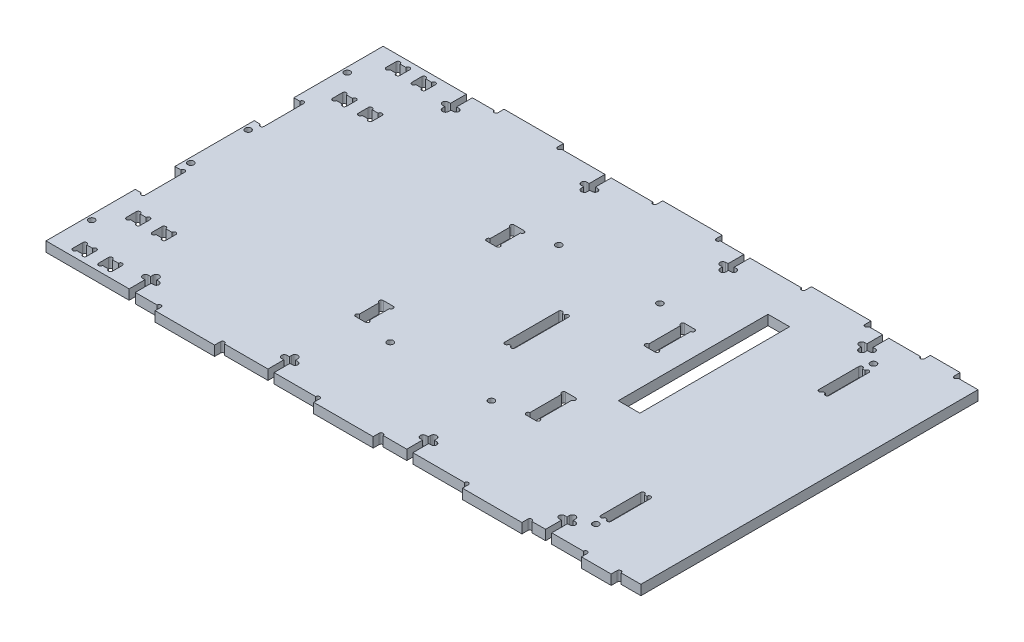
from build123d import *

# Parameters (mm, degrees)
SKETCH_1_W           = 300
SKETCH_1_H           = 170
EXTRUDE_1_DEPTH      = 5
SKETCH_2_W           = 5.2
SKETCH_2_H           = 27
SKETCH_2_H_2         = 20
CUT_EXTRUDE_1_DEPTH  = 10
SKETCH_3_R           = 1.55
CUT_EXTRUDE_2_DEPTH  = 10
SKETCH_4_W           = 5
SKETCH_4_H           = 20
CUT_EXTRUDE_3_DEPTH  = 5
SKETCH_5_R           = 1
CUT_EXTRUDE_4_DEPTH  = 10
SKETCH_8_W           = 30
SKETCH_8_H           = 3
SKETCH_8_W_2         = 15
EXTRUDE_2_DEPTH      = 5
SKETCH_9_R           = 1
CUT_EXTRUDE_6_DEPTH  = 5
SKETCH_13_W          = 7
SKETCH_13_H          = 5
CUT_EXTRUDE_9_DEPTH  = 10
SKETCH_14_R          = 1
CUT_EXTRUDE_10_DEPTH = 10
SKETCH_15_W          = 5
SKETCH_15_H          = 14
SKETCH_15_H_2        = 20
CUT_EXTRUDE_11_DEPTH = 10
SKETCH_16_R          = 1
CUT_EXTRUDE_12_DEPTH = 10
SKETCH_17_W          = 10.9
SKETCH_17_H          = 75.5
CUT_EXTRUDE_13_DEPTH = 10
CUT_EXTRUDE_5_DEPTH  = 10
SKETCH_18_R          = 6
CUT_EXTRUDE_14_DEPTH = 1.5
SKETCH_19_W          = 5.2
SKETCH_19_H          = 11.778826781
SKETCH_19_H_2        = 11.694797023
SKETCH_19_H_3        = 17.375654454
SKETCH_19_H_4        = 17.66182615
CUT_EXTRUDE_15_DEPTH = 10


with BuildPart() as part:
    # 스케치1 → 보스-돌출1 (new body)
    with BuildSketch(Plane(origin=(0, 0, 0), x_dir=(1, 0, 0), z_dir=(0, 1, 0))):
        with Locations((150, 85)):
            Rectangle(SKETCH_1_W, SKETCH_1_H)
    extrude(amount=EXTRUDE_1_DEPTH)

    # 스케치2 → 컷-돌출1 (cut)
    with BuildSketch(Plane.XZ):
        with Locations((162.5, -85)):
            Rectangle(SKETCH_2_W, SKETCH_2_H)
        with Locations((262.4, -30)):
            Rectangle(SKETCH_2_W, SKETCH_2_H_2)
        with Locations((262.4, -140)):
            Rectangle(SKETCH_2_W, SKETCH_2_H_2)
    extrude(amount=-CUT_EXTRUDE_1_DEPTH, mode=Mode.SUBTRACT)

    # 스케치3 → 컷-돌출2 (cut)
    with BuildSketch(Plane(origin=(0, 5, 0), x_dir=(1, 0, 0), z_dir=(0, 1, 0))):
        with Locations((131.1, 127.5)):
            Circle(SKETCH_3_R)
        with Locations((182.1, 127.5)):
            Circle(SKETCH_3_R)
        with Locations((182.1, 42.5)):
            Circle(SKETCH_3_R)
        with Locations((131.1, 42.5)):
            Circle(SKETCH_3_R)
        with Locations((2.5, 70.55)):
            Circle(SKETCH_3_R)
        with Locations((2.5, 20.55)):
            Circle(SKETCH_3_R)
        with Locations((2.5, 99.45)):
            Circle(SKETCH_3_R)
        with Locations((2.5, 149.45)):
            Circle(SKETCH_3_R)
        with Locations((262.3, 155)):
            Circle(SKETCH_3_R)
        with Locations((262.3, 15)):
            Circle(SKETCH_3_R)
    extrude(amount=-CUT_EXTRUDE_2_DEPTH, mode=Mode.SUBTRACT)

    # 스케치4 → 컷-돌출3 (cut)
    with BuildSketch(Plane.XZ):
        with Locations((2.5, -115)):
            Rectangle(SKETCH_4_W, SKETCH_4_H)
        with Locations((2.5, -55)):
            Rectangle(SKETCH_4_W, SKETCH_4_H)
    extrude(amount=-CUT_EXTRUDE_3_DEPTH, mode=Mode.SUBTRACT)

    # 스케치5 → 컷-돌출4 (cut)
    with BuildSketch(Plane.XZ):
        with Locations((4, -45)):
            Circle(SKETCH_5_R)
        with Locations((4, -65)):
            Circle(SKETCH_5_R)
        with Locations((4, -105)):
            Circle(SKETCH_5_R)
        with Locations((4, -125)):
            Circle(SKETCH_5_R)
        with Locations((164.1, -98.5)):
            Circle(SKETCH_5_R)
        with Locations((160.9, -98.5)):
            Circle(SKETCH_5_R)
        with Locations((164.1, -71.5)):
            Circle(SKETCH_5_R)
        with Locations((160.9, -71.5)):
            Circle(SKETCH_5_R)
        with Locations((264, -20)):
            Circle(SKETCH_5_R)
        with Locations((260.8, -20)):
            Circle(SKETCH_5_R)
        with Locations((264, -40)):
            Circle(SKETCH_5_R)
        with Locations((260.8, -40)):
            Circle(SKETCH_5_R)
        with Locations((264, -130)):
            Circle(SKETCH_5_R)
        with Locations((260.8, -130)):
            Circle(SKETCH_5_R)
        with Locations((264, -150)):
            Circle(SKETCH_5_R)
        with Locations((260.8, -150)):
            Circle(SKETCH_5_R)
    extrude(amount=-CUT_EXTRUDE_4_DEPTH, mode=Mode.SUBTRACT)

    # 스케치8 → 보스-돌출2 (add)
    with BuildSketch(Plane.XZ):
        with Locations((73, 1.5)):
            Rectangle(SKETCH_8_W, SKETCH_8_H)
        with Locations((153, 1.5)):
            Rectangle(SKETCH_8_W, SKETCH_8_H)
        with Locations((228, 1.5)):
            Rectangle(SKETCH_8_W, SKETCH_8_H)
        with Locations((280.5, 1.5)):
            Rectangle(SKETCH_8_W_2, SKETCH_8_H)
        with Locations((280.5, -171.5)):
            Rectangle(SKETCH_8_W_2, SKETCH_8_H)
        with Locations((228, -171.5)):
            Rectangle(SKETCH_8_W, SKETCH_8_H)
        with Locations((153, -171.5)):
            Rectangle(SKETCH_8_W, SKETCH_8_H)
        with Locations((73, -171.5)):
            Rectangle(SKETCH_8_W, SKETCH_8_H)
    extrude(amount=-EXTRUDE_2_DEPTH)

    # 스케치9 → 컷-돌출6 (cut)
    with BuildSketch(Plane.XZ):
        with Locations((57, 0)):
            Circle(SKETCH_9_R)
        with Locations((89, 0)):
            Circle(SKETCH_9_R)
        with Locations((137, 0)):
            Circle(SKETCH_9_R)
        with Locations((169, 0)):
            Circle(SKETCH_9_R)
        with Locations((212, 0)):
            Circle(SKETCH_9_R)
        with Locations((272, 0)):
            Circle(SKETCH_9_R)
        with Locations((244, 0)):
            Circle(SKETCH_9_R)
        with Locations((289, 0)):
            Circle(SKETCH_9_R)
        with Locations((289, -170)):
            Circle(SKETCH_9_R)
        with Locations((244, -170)):
            Circle(SKETCH_9_R)
        with Locations((272, -170)):
            Circle(SKETCH_9_R)
        with Locations((212, -170)):
            Circle(SKETCH_9_R)
        with Locations((169, -170)):
            Circle(SKETCH_9_R)
        with Locations((137, -170)):
            Circle(SKETCH_9_R)
        with Locations((89, -170)):
            Circle(SKETCH_9_R)
        with Locations((57, -170)):
            Circle(SKETCH_9_R)
    extrude(amount=-CUT_EXTRUDE_6_DEPTH, mode=Mode.SUBTRACT)

    # 스케치13 → 컷-돌출9 (cut)
    with BuildSketch(Plane(origin=(0, 5, 0), x_dir=(1, 0, 0), z_dir=(0, 1, 0))):
        with Locations((26.5, 6.000000001)):
            Rectangle(SKETCH_13_W, SKETCH_13_H)
        with Locations((13.5, 6.000000001)):
            Rectangle(SKETCH_13_W, SKETCH_13_H)
        with Locations((13.5, 33.000000001)):
            Rectangle(SKETCH_13_W, SKETCH_13_H)
        with Locations((26.5, 33.000000001)):
            Rectangle(SKETCH_13_W, SKETCH_13_H)
        with Locations((26.5, 136.999999999)):
            Rectangle(SKETCH_13_W, SKETCH_13_H)
        with Locations((13.5, 136.999999999)):
            Rectangle(SKETCH_13_W, SKETCH_13_H)
        with Locations((13.5, 163.999999999)):
            Rectangle(SKETCH_13_W, SKETCH_13_H)
        with Locations((26.5, 163.999999999)):
            Rectangle(SKETCH_13_W, SKETCH_13_H)
    extrude(amount=-CUT_EXTRUDE_9_DEPTH, mode=Mode.SUBTRACT)

    # 스케치14 → 컷-돌출10 (cut)
    with BuildSketch(Plane.XZ):
        with Locations((11, -8.500000001)):
            Circle(SKETCH_14_R)
        with Locations((11, -3.500000001)):
            Circle(SKETCH_14_R)
        with Locations((16, -3.500000001)):
            Circle(SKETCH_14_R)
        with Locations((16, -8.500000001)):
            Circle(SKETCH_14_R)
        with Locations((24, -8.500000001)):
            Circle(SKETCH_14_R)
        with Locations((24, -3.500000001)):
            Circle(SKETCH_14_R)
        with Locations((29, -3.500000001)):
            Circle(SKETCH_14_R)
        with Locations((29, -8.500000001)):
            Circle(SKETCH_14_R)
        with Locations((29, -30.500000001)):
            Circle(SKETCH_14_R)
        with Locations((29, -35.500000001)):
            Circle(SKETCH_14_R)
        with Locations((24, -35.500000001)):
            Circle(SKETCH_14_R)
        with Locations((24, -30.500000001)):
            Circle(SKETCH_14_R)
        with Locations((16, -30.500000001)):
            Circle(SKETCH_14_R)
        with Locations((16, -35.500000001)):
            Circle(SKETCH_14_R)
        with Locations((11, -35.500000001)):
            Circle(SKETCH_14_R)
        with Locations((11, -30.500000001)):
            Circle(SKETCH_14_R)
        with Locations((11, -139.499999999)):
            Circle(SKETCH_14_R)
        with Locations((11, -134.499999999)):
            Circle(SKETCH_14_R)
        with Locations((16, -134.499999999)):
            Circle(SKETCH_14_R)
        with Locations((16, -139.499999999)):
            Circle(SKETCH_14_R)
        with Locations((24, -139.499999999)):
            Circle(SKETCH_14_R)
        with Locations((24, -134.499999999)):
            Circle(SKETCH_14_R)
        with Locations((29, -134.499999999)):
            Circle(SKETCH_14_R)
        with Locations((29, -139.499999999)):
            Circle(SKETCH_14_R)
        with Locations((29, -161.499999999)):
            Circle(SKETCH_14_R)
        with Locations((29, -166.499999999)):
            Circle(SKETCH_14_R)
        with Locations((24, -166.499999999)):
            Circle(SKETCH_14_R)
        with Locations((24, -161.499999999)):
            Circle(SKETCH_14_R)
        with Locations((16, -161.499999999)):
            Circle(SKETCH_14_R)
        with Locations((16, -166.499999999)):
            Circle(SKETCH_14_R)
        with Locations((11, -166.499999999)):
            Circle(SKETCH_14_R)
        with Locations((11, -161.499999999)):
            Circle(SKETCH_14_R)
    extrude(amount=-CUT_EXTRUDE_10_DEPTH, mode=Mode.SUBTRACT)

    # 스케치15 → 컷-돌출11 (cut)
    with BuildSketch(Plane(origin=(0, 5, 0), x_dir=(1, 0, 0), z_dir=(0, 1, 0))):
        with Locations((113.6, 118)):
            Rectangle(SKETCH_15_W, SKETCH_15_H)
        with Locations((113.6, 52)):
            Rectangle(SKETCH_15_W, SKETCH_15_H)
        with Locations((199.6, 55)):
            Rectangle(SKETCH_15_W, SKETCH_15_H_2)
        with Locations((199.6, 115)):
            Rectangle(SKETCH_15_W, SKETCH_15_H_2)
    extrude(amount=-CUT_EXTRUDE_11_DEPTH, mode=Mode.SUBTRACT)

    # 스케치16 → 컷-돌출12 (cut)
    with BuildSketch(Plane(origin=(0, 5, 0), x_dir=(1, 0, 0), z_dir=(0, 1, 0))):
        with Locations((111.1, 46)):
            Circle(SKETCH_16_R)
        with Locations((116.1, 46)):
            Circle(SKETCH_16_R)
        with Locations((116.1, 58)):
            Circle(SKETCH_16_R)
        with Locations((111.1, 58)):
            Circle(SKETCH_16_R)
        with Locations((111.1, 112)):
            Circle(SKETCH_16_R)
        with Locations((116.1, 112)):
            Circle(SKETCH_16_R)
        with Locations((116.1, 124)):
            Circle(SKETCH_16_R)
        with Locations((111.1, 124)):
            Circle(SKETCH_16_R)
        with Locations((202.1, 124)):
            Circle(SKETCH_16_R)
        with Locations((197.1, 124)):
            Circle(SKETCH_16_R)
        with Locations((197.1, 64)):
            Circle(SKETCH_16_R)
        with Locations((202.1, 64)):
            Circle(SKETCH_16_R)
        with Locations((202.1, 106)):
            Circle(SKETCH_16_R)
        with Locations((197.1, 106)):
            Circle(SKETCH_16_R)
        with Locations((197.1, 46)):
            Circle(SKETCH_16_R)
        with Locations((202.1, 46)):
            Circle(SKETCH_16_R)
    extrude(amount=-CUT_EXTRUDE_12_DEPTH, mode=Mode.SUBTRACT)

    # 스케치17 → 컷-돌출13 (cut)
    with BuildSketch(Plane(origin=(0, 5, 0), x_dir=(1, 0, 0), z_dir=(0, 1, 0))):
        with Locations((219.55, 112.25)):
            Rectangle(SKETCH_17_W, SKETCH_17_H)
    extrude(amount=-CUT_EXTRUDE_13_DEPTH, mode=Mode.SUBTRACT)

    # 스케치7 → 컷-돌출5 (cut)
    with BuildSketch(Plane.XZ):
        with BuildLine():
            Line((115.028741621, -170), (111.928741621, -170))
            Line((111.928741621, -170), (111.928741621, -162))
            Line((111.928741621, -162), (110.728741621, -162))
            ThreePointArc((110.728741621, -162), (109.328741621, -160.6), (110.728741621, -159.2))
            Line((110.728741621, -159.2), (111.928741621, -159.2))
            Line((111.928741621, -159.2), (111.928741621, -158))
            ThreePointArc((111.928741621, -158), (113.478741621, -156.45), (115.028741621, -158))
            Line((115.028741621, -158), (115.028741621, -159.2))
            Line((115.028741621, -159.2), (116.228741621, -159.2))
            ThreePointArc((116.228741621, -159.2), (117.628741621, -160.6), (116.228741621, -162))
            Line((116.228741621, -162), (115.028741621, -162))
            Line((115.028741621, -162), (115.028741621, -170))
        make_face()
        with BuildLine():
            Line((185.028741621, -170), (181.928741621, -170))
            Line((181.928741621, -170), (181.928741621, -162))
            Line((181.928741621, -162), (180.728741621, -162))
            ThreePointArc((180.728741621, -162), (179.328741621, -160.6), (180.728741621, -159.2))
            Line((180.728741621, -159.2), (181.928741621, -159.2))
            Line((181.928741621, -159.2), (181.928741621, -158))
            ThreePointArc((181.928741621, -158), (183.478741621, -156.45), (185.028741621, -158))
            Line((185.028741621, -158), (185.028741621, -159.2))
            Line((185.028741621, -159.2), (186.228741621, -159.2))
            ThreePointArc((186.228741621, -159.2), (187.628741621, -160.6), (186.228741621, -162))
            Line((186.228741621, -162), (185.028741621, -162))
            Line((185.028741621, -162), (185.028741621, -170))
        make_face()
        with BuildLine():
            Line((255.028741621, -170), (251.928741621, -170))
            Line((251.928741621, -170), (251.928741621, -162))
            Line((251.928741621, -162), (250.728741621, -162))
            ThreePointArc((250.728741621, -162), (249.328741621, -160.6), (250.728741621, -159.2))
            Line((250.728741621, -159.2), (251.928741621, -159.2))
            Line((251.928741621, -159.2), (251.928741621, -158))
            ThreePointArc((251.928741621, -158), (253.478741621, -156.45), (255.028741621, -158))
            Line((255.028741621, -158), (255.028741621, -159.2))
            Line((255.028741621, -159.2), (256.228741621, -159.2))
            ThreePointArc((256.228741621, -159.2), (257.628741621, -160.6), (256.228741621, -162))
            Line((256.228741621, -162), (255.028741621, -162))
            Line((255.028741621, -162), (255.028741621, -170))
        make_face()
        with BuildLine():
            Line((46.228741621, -10.8), (45.028741621, -10.8))
            Line((45.028741621, -10.8), (45.028741621, -12))
            ThreePointArc((45.028741621, -12), (43.478741621, -13.55), (41.928741621, -12))
            Line((41.928741621, -12), (41.928741621, -10.8))
            Line((41.928741621, -10.8), (40.728741621, -10.8))
            ThreePointArc((40.728741621, -10.8), (39.328741621, -9.4), (40.728741621, -8))
            Line((40.728741621, -8), (41.928741621, -8))
            Line((41.928741621, -8), (41.928741621, 0))
            Line((41.928741621, 0), (45.028741621, 0))
            Line((45.028741621, 0), (45.028741621, -8))
            Line((45.028741621, -8), (46.228741621, -8))
            ThreePointArc((46.228741621, -8), (47.628741621, -9.4), (46.228741621, -10.8))
        make_face()
        with BuildLine():
            Line((45.028741621, -170), (41.928741621, -170))
            Line((41.928741621, -170), (41.928741621, -162))
            Line((41.928741621, -162), (40.728741621, -162))
            ThreePointArc((40.728741621, -162), (39.328741621, -160.6), (40.728741621, -159.2))
            Line((40.728741621, -159.2), (41.928741621, -159.2))
            Line((41.928741621, -159.2), (41.928741621, -158))
            ThreePointArc((41.928741621, -158), (43.478741621, -156.45), (45.028741621, -158))
            Line((45.028741621, -158), (45.028741621, -159.2))
            Line((45.028741621, -159.2), (46.228741621, -159.2))
            ThreePointArc((46.228741621, -159.2), (47.628741621, -160.6), (46.228741621, -162))
            Line((46.228741621, -162), (45.028741621, -162))
            Line((45.028741621, -162), (45.028741621, -170))
        make_face()
        with BuildLine():
            Line((256.228741621, -10.8), (255.028741621, -10.8))
            Line((255.028741621, -10.8), (255.028741621, -12))
            ThreePointArc((255.028741621, -12), (253.478741621, -13.55), (251.928741621, -12))
            Line((251.928741621, -12), (251.928741621, -10.8))
            Line((251.928741621, -10.8), (250.728741621, -10.8))
            ThreePointArc((250.728741621, -10.8), (249.328741621, -9.4), (250.728741621, -8))
            Line((250.728741621, -8), (251.928741621, -8))
            Line((251.928741621, -8), (251.928741621, 0))
            Line((251.928741621, 0), (255.028741621, 0))
            Line((255.028741621, 0), (255.028741621, -8))
            Line((255.028741621, -8), (256.228741621, -8))
            ThreePointArc((256.228741621, -8), (257.628741621, -9.4), (256.228741621, -10.8))
        make_face()
        with BuildLine():
            Line((186.228741621, -10.8), (185.028741621, -10.8))
            Line((185.028741621, -10.8), (185.028741621, -12))
            ThreePointArc((185.028741621, -12), (183.478741621, -13.55), (181.928741621, -12))
            Line((181.928741621, -12), (181.928741621, -10.8))
            Line((181.928741621, -10.8), (180.728741621, -10.8))
            ThreePointArc((180.728741621, -10.8), (179.328741621, -9.4), (180.728741621, -8))
            Line((180.728741621, -8), (181.928741621, -8))
            Line((181.928741621, -8), (181.928741621, 0))
            Line((181.928741621, 0), (185.028741621, 0))
            Line((185.028741621, 0), (185.028741621, -8))
            Line((185.028741621, -8), (186.228741621, -8))
            ThreePointArc((186.228741621, -8), (187.628741621, -9.4), (186.228741621, -10.8))
        make_face()
        with BuildLine():
            Line((116.228741621, -10.8), (115.028741621, -10.8))
            Line((115.028741621, -10.8), (115.028741621, -12))
            ThreePointArc((115.028741621, -12), (113.478741621, -13.55), (111.928741621, -12))
            Line((111.928741621, -12), (111.928741621, -10.8))
            Line((111.928741621, -10.8), (110.728741621, -10.8))
            ThreePointArc((110.728741621, -10.8), (109.328741621, -9.4), (110.728741621, -8))
            Line((110.728741621, -8), (111.928741621, -8))
            Line((111.928741621, -8), (111.928741621, 0))
            Line((111.928741621, 0), (115.028741621, 0))
            Line((115.028741621, 0), (115.028741621, -8))
            Line((115.028741621, -8), (116.228741621, -8))
            ThreePointArc((116.228741621, -8), (117.628741621, -9.4), (116.228741621, -10.8))
        make_face()
    extrude(amount=-CUT_EXTRUDE_5_DEPTH, mode=Mode.SUBTRACT)

    # 스케치18 → 컷-돌출14 (cut)
    with BuildSketch(Plane.XZ):
        with Locations((15, -17.5)):
            Circle(SKETCH_18_R)
        with Locations((15, -152.5)):
            Circle(SKETCH_18_R)
        with Locations((285, -17.5)):
            Circle(SKETCH_18_R)
        with Locations((285, -152.5)):
            Circle(SKETCH_18_R)
    extrude(amount=-CUT_EXTRUDE_14_DEPTH, mode=Mode.SUBTRACT)

    # 스케치19 → 컷-돌출15 (cut)
    with BuildSketch(Plane(origin=(0, 5, 0), x_dir=(1, 0, 0), z_dir=(0, 1, 0))):
        with Locations((113.6, 118.024605115)):
            Rectangle(SKETCH_19_W, SKETCH_19_H)
        with Locations((113.6, 52.140636728)):
            Rectangle(SKETCH_19_W, SKETCH_19_H_2)
        with Locations((199.6, 55.305919248)):
            Rectangle(SKETCH_19_W, SKETCH_19_H_3)
        with Locations((199.6, 115.08310543)):
            Rectangle(SKETCH_19_W, SKETCH_19_H_4)
    extrude(amount=-CUT_EXTRUDE_15_DEPTH, mode=Mode.SUBTRACT)


solid = part.part
